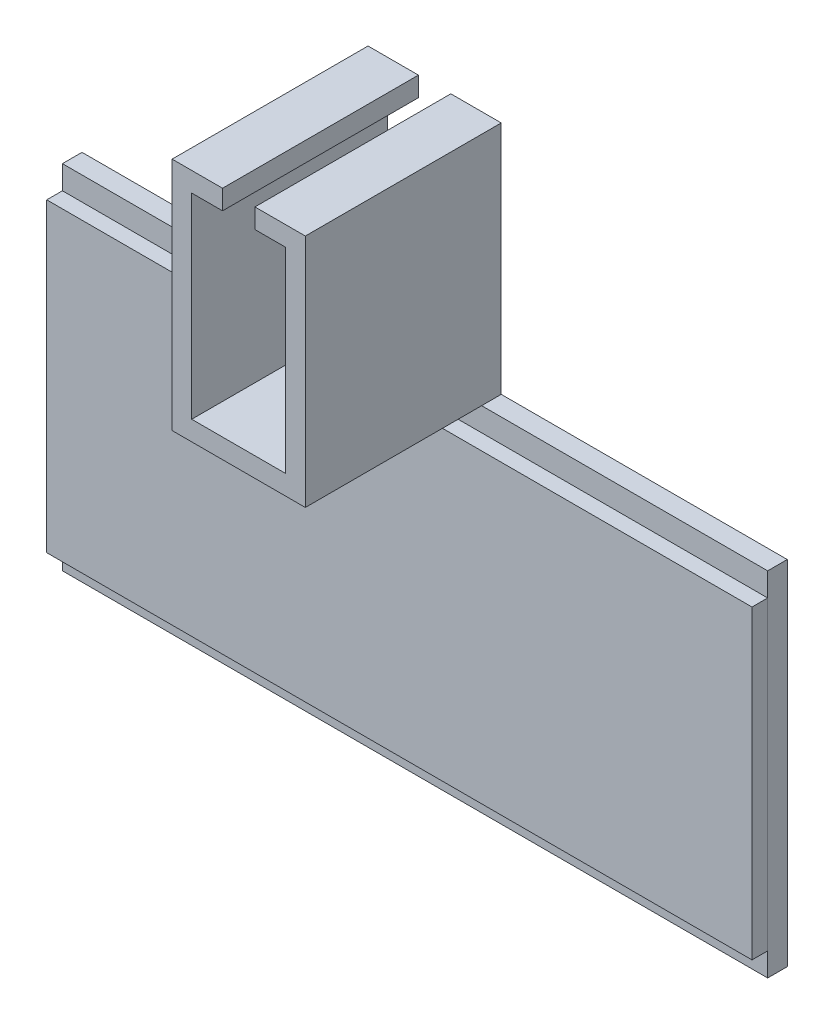
from build123d import *

# Parameters (mm, degrees)
AUFSATZ_LINEAR_AUSTRAGEN1_DEPTH = 500
SKIZZE2_W                       = 450
SKIZZE2_H                       = 900
SCHNITT_LINEAR_AUSTRAGEN1_DEPTH = 2096.829191513
SKIZZE3_W                       = 40
SKIZZE3_H                       = 780
AUFSATZ_LINEAR_AUSTRAGEN2_DEPTH = 1800


with BuildPart() as part:
    # Skizze1 → Aufsatz-Linear austragen1 (new body)
    with BuildSketch(Plane.XY):
        Polygon((-120, 0), (120, 0), (120, 500), (41.348314607, 500), (41.348314607, 550), (170, 550), (170, -50), (900, -50), (900, -950), (513.483146067, -950), (-513.483146067, -950), (-900, -950), (-900, -50), (-170, -50), (-170, 550), (-41.348314607, 550), (-41.348314607, 500), (-120, 500), align=None)
    extrude(amount=AUFSATZ_LINEAR_AUSTRAGEN1_DEPTH)

    # Skizze2 → Schnitt-Linear austragen1 (cut, through all)
    with BuildSketch(Plane(origin=(900, 0, 0), x_dir=(0, 0, -1), z_dir=(1, 0, 0))):
        with Locations((-275, -500)):
            Rectangle(SKIZZE2_W, SKIZZE2_H)
    extrude(amount=-SCHNITT_LINEAR_AUSTRAGEN1_DEPTH, mode=Mode.SUBTRACT)


with BuildPart() as body_2:
    # Skizze3 → Aufsatz-Linear austragen2 (new body)
    with BuildSketch(Plane(origin=(900, 0, 0), x_dir=(0, 0, -1), z_dir=(1, 0, 0))):
        with Locations((-70, -500)):
            Rectangle(SKIZZE3_W, SKIZZE3_H)
    extrude(amount=-AUFSATZ_LINEAR_AUSTRAGEN2_DEPTH)


solid = Compound([part.part, body_2.part])
